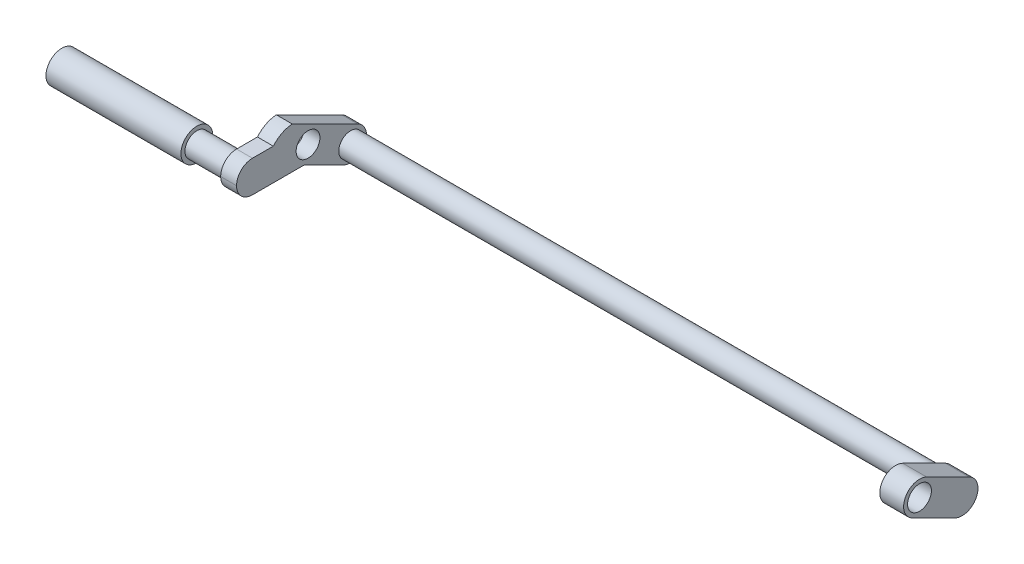
from build123d import *

# Parameters (mm, degrees)
SKETCH2_R            = 2
BOSS_EXTRUDE1_DEPTH  = 17
SKETCH3_R            = 1.5
BOSS_EXTRUDE2_DEPTH  = 7
SKETCH4_W            = 3.988125856
SKETCH4_H            = 4
BOSS_EXTRUDE3_DEPTH  = 2
SKETCH5_W            = 2
SKETCH5_H            = 4
BOSS_EXTRUDE4_DEPTH  = 11
FILLET1_R            = 2
FILLET2_R            = 2
FILLET3_R            = 2
SKETCH6_R            = 1.5
CUT_EXTRUDE1_DEPTH   = 26.709920264
BOSS_EXTRUDE8_START  = -2
BOSS_EXTRUDE8_DEPTH  = 2
SKETCH11_R           = 1.5
BOSS_EXTRUDE9_DEPTH  = 74
SKETCH13_R           = 2
SKETCH13_R_2         = 1.5
BOSS_EXTRUDE10_DEPTH = 3


# Read off the part's stored shape, not the designer's step: Boss-Extrude8
with BuildPart() as part:
    # Sketch2 → Boss-Extrude1 (new body)
    with BuildSketch(Plane(origin=(0, 0, 0), x_dir=(0, 0, -1), z_dir=(1, 0, 0))):
        Circle(SKETCH2_R)
    extrude(amount=BOSS_EXTRUDE1_DEPTH)

    # Sketch3 → Boss-Extrude2 (add)
    with BuildSketch(Plane(origin=(17, 0, 0), x_dir=(0, 0, -1), z_dir=(1, 0, 0))):
        Circle(SKETCH3_R)
    extrude(amount=BOSS_EXTRUDE2_DEPTH)

    # Sketch4 → Boss-Extrude3 (add)
    with BuildSketch(Plane(origin=(24, 0, 0), x_dir=(0, 0, -1), z_dir=(1, 0, 0))):
        with Locations((-0.005937072, 0)):
            Rectangle(SKETCH4_W, SKETCH4_H)
    extrude(amount=-BOSS_EXTRUDE3_DEPTH)

    # Sketch5 → Boss-Extrude4 (add)
    with BuildSketch(Plane.XY.offset(2)):
        with Locations((23, 0)):
            Rectangle(SKETCH5_W, SKETCH5_H)
    extrude(amount=-BOSS_EXTRUDE4_DEPTH)

    # Fillet1
    fillet1_edges = [part.edges().sort_by_distance(p)[0] for p in [
        (23, 2, 2),
    ]]
    fillet(fillet1_edges, radius=FILLET1_R)

    # Fillet2
    fillet2_edges = [part.edges().sort_by_distance(p)[0] for p in [
        (23, -2, 2),
    ]]
    fillet(fillet2_edges, radius=FILLET2_R - 0.0001)  # a hair under: the kernel refuses the full size

    # Fillet3
    fillet3_edges = [part.edges().sort_by_distance(p)[0] for p in [
        (23, -2, -9),
        (23, 2, -9),
    ]]
    fillet(fillet3_edges, radius=FILLET3_R - 0.0001)  # a hair under: the kernel refuses the full size

    # Sketch6 → Cut-Extrude1 (cut, through all)
    with BuildSketch(Plane(origin=(24, 0, 0), x_dir=(0, 0, -1), z_dir=(1, 0, 0))):
        with Locations((7, 0)):
            Circle(SKETCH6_R)
    extrude(amount=-CUT_EXTRUDE1_DEPTH, mode=Mode.SUBTRACT)

    # Boss-Extrude8 outline → Boss-Extrude8 (add)
    with BuildSketch(Plane(origin=(24, 0, 0), x_dir=(0, 0, -1), z_dir=(1, 0, 0)).offset(BOSS_EXTRUDE8_START)):
        with BuildLine():
            Line((7.893788641, 1.789173514), (5.005331724, 3.232113464))
            ThreePointArc((5.005331724, 3.232113464), (3.692949686, 2.855553556), (2.628913929, 2))
            Line((2.628913929, 2), (7, 2))
            ThreePointArc((7, 2), (7.459158453, 1.946579953), (7.893788641, 1.789173514))
        make_face()
        with BuildLine():
            Line((13.26130919, -0.892192368), (7.893788641, 1.789173514))
            ThreePointArc((7.893788641, 1.789173514), (8.701113941, 1.051765829), (9, 0))
            ThreePointArc((9, 0), (8.414213562, -1.414213562), (7, -2))
            Line((7, -2), (6.528240855, -2))
            Line((6.528240855, -2), (11.473731932, -4.470539409))
            ThreePointArc((11.473731932, -4.470539409), (14.156694081, -3.575154517), (13.26130919, -0.892192368))
        make_face()
    extrude(amount=BOSS_EXTRUDE8_DEPTH)

    # Sketch11 → Boss-Extrude9 (add)
    with BuildSketch(Plane(origin=(24, 0, 0), x_dir=(0, 0, -1), z_dir=(1, 0, 0))):
        with Locations((12.367520561, -2.681365888)):
            Circle(SKETCH11_R)
    extrude(amount=BOSS_EXTRUDE9_DEPTH)

    # Sketch13 → Boss-Extrude10 (add)
    # profile 1 of 4: a face of its own
    with BuildSketch(Plane(origin=(98, 0, 0), x_dir=(0, 0, -1), z_dir=(1, 0, 0))):
        with Locations((7, 0)):
            Circle(SKETCH13_R)
        with Locations((7, 0)):
            Circle(SKETCH13_R_2, mode=Mode.SUBTRACT)
    # profile 2 of 4: a face of its own
    with BuildSketch(Plane(origin=(98, 0, 0), x_dir=(0, 0, -1), z_dir=(1, 0, 0))):
        with Locations((12.367520561, -2.681365888)):
            Circle(SKETCH13_R)
        with Locations((12.367520561, -2.681365888)):
            Circle(SKETCH13_R_2, mode=Mode.SUBTRACT)
    # profile 3 of 4: a face of its own
    with BuildSketch(Plane(origin=(98, 0, 0), x_dir=(0, 0, -1), z_dir=(1, 0, 0))):
        with BuildLine():
            ThreePointArc((9, 0), (8.051765834, -1.701113938), (6.106211371, -1.78917352))
            Line((6.106211371, -1.78917352), (11.473731932, -4.470539409))
            ThreePointArc((11.473731932, -4.470539409), (10.578347041, -1.787577259), (13.26130919, -0.892192368))
            Line((13.26130919, -0.892192368), (7.893788629, 1.78917352))
            ThreePointArc((7.893788629, 1.78917352), (8.701113938, 1.051765834), (9, 0))
        make_face()
    # profile 4 of 4: a face of its own
    with BuildSketch(Plane(origin=(98, 0, 0), x_dir=(0, 0, -1), z_dir=(1, 0, 0))):
        with Locations((12.367520561, -2.681365888)):
            Circle(SKETCH13_R_2)
    extrude(amount=BOSS_EXTRUDE10_DEPTH)


solid = part.part
